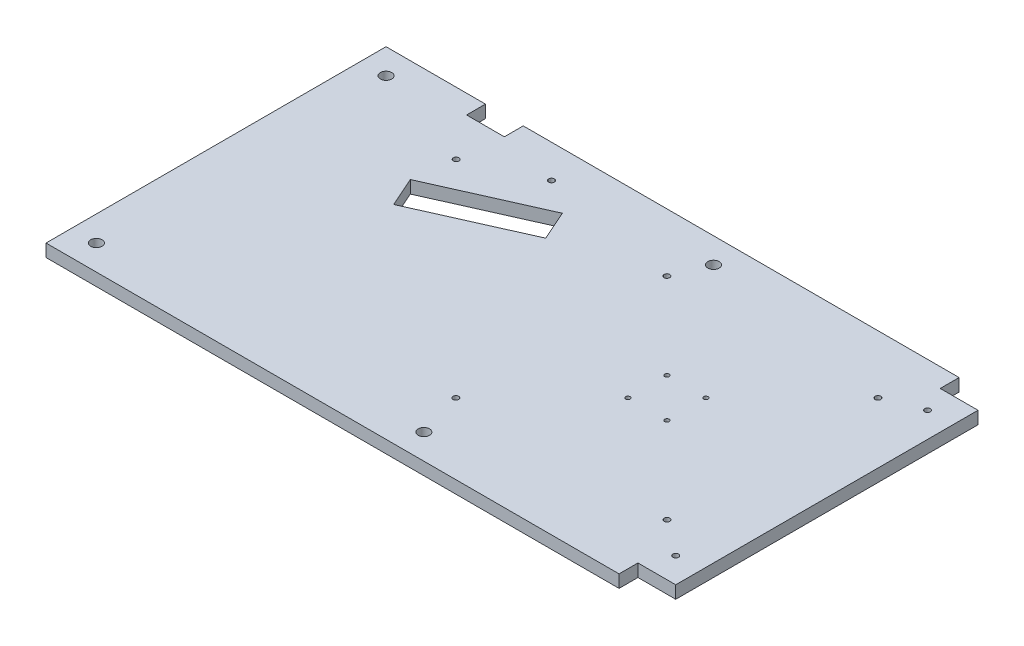
from build123d import *

# Parameters (mm, degrees)
SCHIZZO1_W                    = 485
SCHIZZO1_H                    = 270
ESTRUSIONE_ESTRUSIONE1_DEPTH  = 10
FORO_PER_VITE_M8_1_OUTLINE_R  = 4.5
FORO_PER_VITE_M8_1_DEPTH      = 10
TAGLIO_ESTRUSIONE1_DEPTH      = 13
TAGLIO_ESTRUSIONE1_DEPTH_BACK = 13
SCHIZZO5_W                    = 91.448812178
SCHIZZO5_H                    = 10
SCHIZZO6_R                    = 2.25
TAGLIO_ESTRUSIONE2_DEPTH      = 10
SCHIZZO7_R                    = 1.75
TAGLIO_ESTRUSIONE3_DEPTH      = 15
SCHIZZO8_R                    = 2.25
TAGLIO_ESTRUSIONE4_DEPTH      = 42.3
SCHIZZO9_W                    = 30
SCHIZZO9_H                    = 15
TAGLIO_ESTRUSIONE5_DEPTH      = 10
SCHIZZO10_R                   = 2.25
TAGLIO_ESTRUSIONE6_DEPTH      = 10


# Read off the part's stored shape, not the designer's step: Foro per Vite M8-1
with BuildPart() as part:
    # Schizzo1 → Estrusione-Estrusione1 (new body)
    with BuildSketch(Plane(origin=(0, 0, 0), x_dir=(1, 0, 0), z_dir=(0, 1, 0))):
        with Locations((-242.5, 135)):
            Rectangle(SCHIZZO1_W, SCHIZZO1_H)
    extrude(amount=ESTRUSIONE_ESTRUSIONE1_DEPTH)

    # Foro per Vite M8-1 outline → Foro per Vite M8-1 (cut)
    with BuildSketch(Plane(origin=(0, 0, 0), x_dir=(1, 0, 0), z_dir=(0, 1, 0))):
        with Locations((-205, 250)):
            Circle(FORO_PER_VITE_M8_1_OUTLINE_R)
        with Locations((-465, 20)):
            Circle(FORO_PER_VITE_M8_1_OUTLINE_R)
        with Locations((-205, 20)):
            Circle(FORO_PER_VITE_M8_1_OUTLINE_R)
        with Locations((-465, 250)):
            Circle(FORO_PER_VITE_M8_1_OUTLINE_R)
    extrude(amount=FORO_PER_VITE_M8_1_DEPTH, mode=Mode.SUBTRACT)

    # Schizzo5 → Taglio-Estrusione1 (cut, two sides: drawn at the far end of the back side and taken through both)
    with BuildSketch(Plane(origin=(-128.208113313, 0, -287.960137213), x_dir=(0.9135454576425992, 0, -0.4067366430758042), z_dir=(0.4067366430758042, 0, 0.9135454576425992)).offset(-TAGLIO_ESTRUSIONE1_DEPTH_BACK)):
        with Locations((-228.551173826, 5)):
            Rectangle(SCHIZZO5_W, SCHIZZO5_H)
    extrude(amount=TAGLIO_ESTRUSIONE1_DEPTH + TAGLIO_ESTRUSIONE1_DEPTH_BACK, mode=Mode.SUBTRACT)

    # Schizzo6 → Taglio-Estrusione2 (cut)
    with BuildSketch(Plane(origin=(0, 10, 0), x_dir=(1, 0, 0), z_dir=(0, 1, 0))):
        with Locations(Location((-48.207846429, 223.792153571, 0), (0, 0, 270))):
            Circle(SCHIZZO6_R)
        with Locations(Location((-215.792153571, 223.792153571, 0), (0, 0, 270))):
            Circle(SCHIZZO6_R)
        with Locations(Location((-215.792153571, 56.207846429, 0), (0, 0, 270))):
            Circle(SCHIZZO6_R)
        with Locations(Location((-48.207846429, 56.207846429, 0), (0, 0, 270))):
            Circle(SCHIZZO6_R)
    extrude(amount=-TAGLIO_ESTRUSIONE2_DEPTH, mode=Mode.SUBTRACT)

    # Schizzo7 → Taglio-Estrusione3 (cut)
    with BuildSketch(Plane(origin=(0, 10, 0), x_dir=(1, 0, 0), z_dir=(0, 1, 0))):
        with Locations(Location((-147.5, 155.5, 0), (0, 0, 270))):
            Circle(SCHIZZO7_R)
        with Locations(Location((-116.5, 155.5, 0), (0, 0, 270))):
            Circle(SCHIZZO7_R)
        with Locations(Location((-116.5, 124.5, 0), (0, 0, 270))):
            Circle(SCHIZZO7_R)
        with Locations(Location((-147.5, 124.5, 0), (0, 0, 270))):
            Circle(SCHIZZO7_R)
    extrude(amount=-TAGLIO_ESTRUSIONE3_DEPTH, mode=Mode.SUBTRACT)

    # Schizzo8 → Taglio-Estrusione4 (cut)
    with BuildSketch(Plane(origin=(0, 10, 0), x_dir=(1, 0, 0), z_dir=(0, 1, 0))):
        with Locations(Location((-327.299756602, 243.651595895, 0), (0, 0, 270))):
            Circle(SCHIZZO8_R)
        with Locations(Location((-379.645911325, 220.345586247, 0), (0, 0, 270))):
            Circle(SCHIZZO8_R)
    extrude(amount=-TAGLIO_ESTRUSIONE4_DEPTH, mode=Mode.SUBTRACT)

    # Schizzo9 → Taglio-Estrusione5 (cut)
    with BuildSketch(Plane(origin=(0, 10, 0), x_dir=(1, 0, 0), z_dir=(0, 1, 0))):
        with Locations((-15, 262.5)):
            Rectangle(SCHIZZO9_W, SCHIZZO9_H)
        with Locations((-15, 7.5)):
            Rectangle(SCHIZZO9_W, SCHIZZO9_H)
        with Locations((-391.074312, 262.5)):
            Rectangle(SCHIZZO9_W, SCHIZZO9_H)
    extrude(amount=-TAGLIO_ESTRUSIONE5_DEPTH, mode=Mode.SUBTRACT)

    # Schizzo10 → Taglio-Estrusione6 (cut)
    with BuildSketch(Plane(origin=(0, 10, 0), x_dir=(1, 0, 0), z_dir=(0, 1, 0))):
        with Locations(Location((-20, 35, 0), (0, 0, 270))):
            Circle(SCHIZZO10_R)
        with Locations(Location((-20, 235, 0), (0, 0, 270))):
            Circle(SCHIZZO10_R)
    extrude(amount=-TAGLIO_ESTRUSIONE6_DEPTH, mode=Mode.SUBTRACT)


solid = part.part
